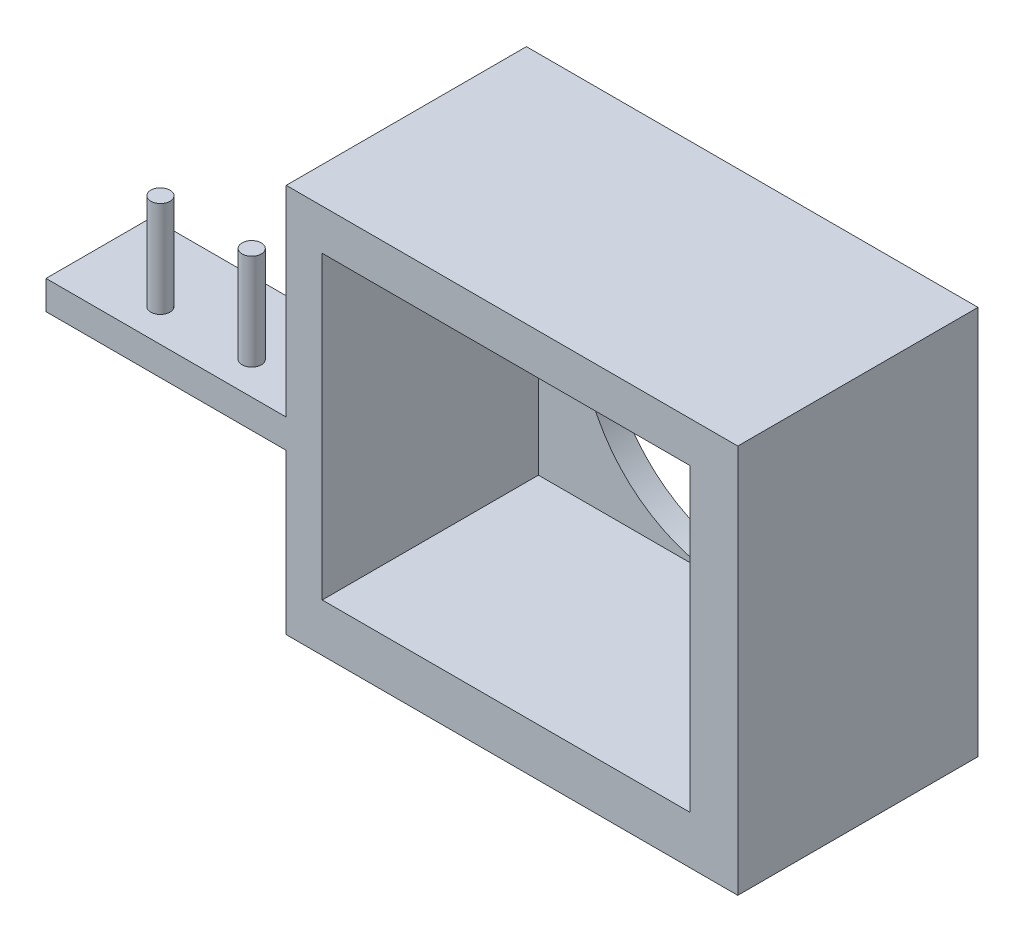
from build123d import *

# Parameters (mm, degrees)
CROQUIS1_W              = 47
CROQUIS1_H              = 40.5
SALIENTE_EXTRUIR1_DEPTH = 25
CROQUIS2_W              = 10.933851529
CROQUIS2_H              = 3
SALIENTE_EXTRUIR2_DEPTH = 25
CROQUIS3_W              = 38.25
CROQUIS3_H              = 31.25
CORTAR_EXTRUIR1_DEPTH   = 22.5
CROQUIS4_W              = 1
CROQUIS4_H              = 10
CROQUIS5_W              = 1
CROQUIS5_H              = 10
CROQUIS6_R              = 15.25
CORTAR_EXTRUIR2_DEPTH   = 10


with BuildPart() as part:
    # Croquis1 → Saliente-Extruir1 (new body)
    with BuildSketch(Plane.XY.offset(25)):
        with Locations((-22.24307249, 34.18630066)):
            Rectangle(CROQUIS1_W, CROQUIS1_H)
    extrude(amount=-SALIENTE_EXTRUIR1_DEPTH)

    # Croquis2 → Saliente-Extruir2 (add)
    with BuildSketch(Plane.ZY.offset(45.74307249)):
        with Locations((19.533074236, 32.04630066)):
            Rectangle(CROQUIS2_W, CROQUIS2_H)
    extrude(amount=SALIENTE_EXTRUIR2_DEPTH)

    # Croquis3 → Cortar-Extruir1 (cut)
    with BuildSketch(Plane.XY.offset(25)):
        with Locations((-22.86807249, 34.56130066)):
            Rectangle(CROQUIS3_W, CROQUIS3_H)
    extrude(amount=-CORTAR_EXTRUIR1_DEPTH, mode=Mode.SUBTRACT)

    # Croquis4 → Revolución1 (revolve)
    with BuildSketch(Plane.XY.offset(21.590447053)):
        with Locations((-52.24307249, 38.54630066)):
            Rectangle(CROQUIS4_W, CROQUIS4_H)
    revolve(axis=Axis((-52.74307249, 43.54630066, 21.590447053), (0, -1, 0)))

    # Croquis5 → Revolución2 (revolve)
    with BuildSketch(Plane.XY.offset(21.590447053)):
        with Locations((-61.74307249, 38.54630066)):
            Rectangle(CROQUIS5_W, CROQUIS5_H)
    revolve(axis=Axis((-62.24307249, 43.54630066, 21.590447053), (0, -1, 0)))

    # Croquis6 → Cortar-Extruir2 (cut)
    with BuildSketch(Plane(origin=(0, 0, 0), x_dir=(-1, 0, 0), z_dir=(0, 0, -1))):
        with Locations((22.24307249, 34.18630066)):
            Circle(CROQUIS6_R)
    extrude(amount=-CORTAR_EXTRUIR2_DEPTH, mode=Mode.SUBTRACT)


solid = part.part
